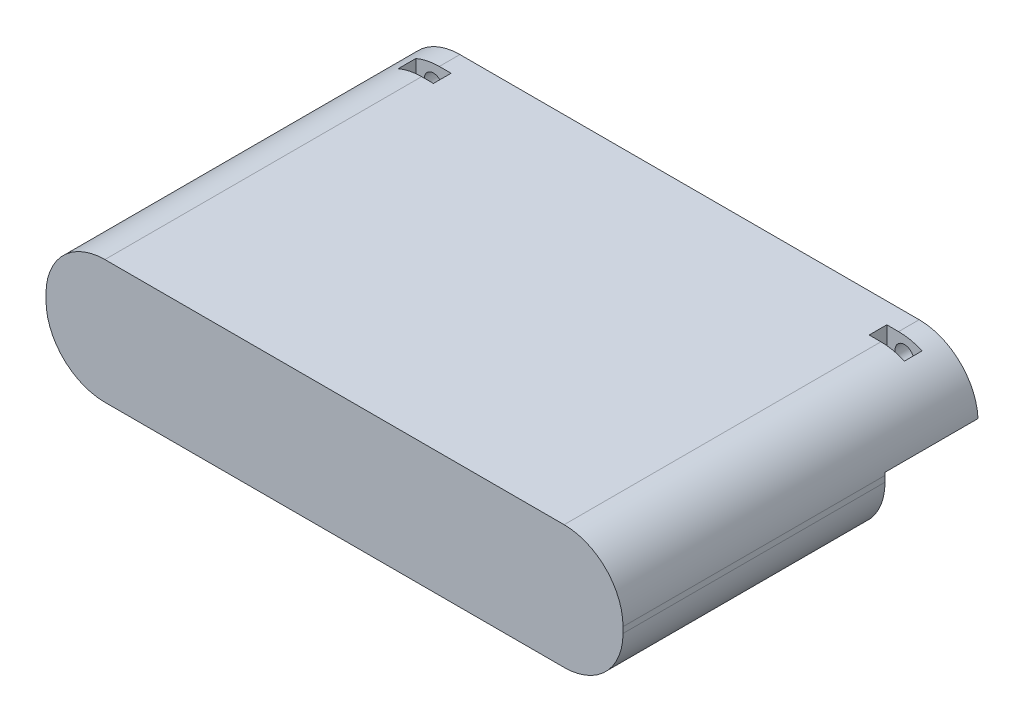
from build123d import *

# Parameters (mm, degrees)
SKETCH_1_W          = 49
SKETCH_1_H          = 21
SKETCH_1_R          = 4.1
SKETCH_1_R_2        = 1.6
EXTRUDE_1_DEPTH     = 57.8
SKETCH_4_W          = 98
SKETCH_4_H          = 11.45
CUT_EXTRUDE_3_DEPTH = 15.8
SKETCH_5_R          = 4.1
CUT_EXTRUDE_4_DEPTH = 42
SKETCH_6_W          = 98
SKETCH_6_H          = 21
EXTRUDE_2_DEPTH     = 2.5
SKETCH_7_R          = 1.6
SKETCH_7_R_2        = 1.534199572
CUT_EXTRUDE_5_DEPTH = 10
SKETCH_8_W          = 6
SKETCH_8_H          = 3
CUT_EXTRUDE_6_DEPTH = 7
FILLET_1_R          = 10
FILLET_2_R          = 10
FILLET_3_R          = 10
FILLET_4_R          = 10


with BuildPart() as part:
    # 草图1 → 凸台-拉伸1 (new body)
    # profile 1 of 6: a face of its own
    with BuildSketch(Plane.XY):
        with Locations((-24.5, 0)):
            Rectangle(SKETCH_1_W, SKETCH_1_H)
        with Locations((-40, -4.5)):
            Circle(SKETCH_1_R, mode=Mode.SUBTRACT)
        with Locations((-40, 7.5)):
            Circle(SKETCH_1_R_2, mode=Mode.SUBTRACT)
    # profile 2 of 6: a face of its own
    with BuildSketch(Plane.XY):
        with Locations((-40, -4.5)):
            Circle(SKETCH_1_R)
    # profile 3 of 6: a face of its own
    with BuildSketch(Plane.XY):
        with Locations((-40, 7.5)):
            Circle(SKETCH_1_R_2)
    # profile 4 of 6: a face of its own
    with BuildSketch(Plane.XY):
        with Locations((24.5, 0)):
            Rectangle(SKETCH_1_W, SKETCH_1_H)
        with Locations((40, -4.5)):
            Circle(SKETCH_1_R, mode=Mode.SUBTRACT)
        with Locations((40, 7.5)):
            Circle(SKETCH_1_R_2, mode=Mode.SUBTRACT)
    # profile 5 of 6: a face of its own
    with BuildSketch(Plane.XY):
        with Locations((40, -4.5)):
            Circle(SKETCH_1_R)
    # profile 6 of 6: a face of its own
    with BuildSketch(Plane.XY):
        with Locations((40, 7.5)):
            Circle(SKETCH_1_R_2)
    extrude(amount=EXTRUDE_1_DEPTH)

    # 草图4 → 切除-拉伸3 (cut)
    with BuildSketch(Plane(origin=(0, 0, 0), x_dir=(-1, 0, 0), z_dir=(0, 0, -1))):
        with Locations((0, -4.775)):
            Rectangle(SKETCH_4_W, SKETCH_4_H)
    extrude(amount=-CUT_EXTRUDE_3_DEPTH, mode=Mode.SUBTRACT)

    # 草图5 → 切除-拉伸4 (cut)
    with BuildSketch(Plane(origin=(0, 0, 15.8), x_dir=(-1, 0, 0), z_dir=(0, 0, -1))):
        with Locations((-40, -4.5)):
            Circle(SKETCH_5_R)
        with Locations((40, -4.5)):
            Circle(SKETCH_5_R)
    extrude(amount=-CUT_EXTRUDE_4_DEPTH, mode=Mode.SUBTRACT)

    # 草图6 → 凸台-拉伸2 (add)
    with BuildSketch(Plane.XY.offset(57.8)):
        Rectangle(SKETCH_6_W, SKETCH_6_H)
    extrude(amount=EXTRUDE_2_DEPTH)

    # 草图7 → 切除-拉伸5 (cut)
    with BuildSketch(Plane(origin=(0, 0, 0), x_dir=(-1, 0, 0), z_dir=(0, 0, -1))):
        with Locations((-40, 7.5)):
            Circle(SKETCH_7_R)
        with Locations((40, 7.5)):
            Circle(SKETCH_7_R_2)
    extrude(amount=-CUT_EXTRUDE_5_DEPTH, mode=Mode.SUBTRACT)

    # 草图8 → 切除-拉伸6 (cut)
    with BuildSketch(Plane(origin=(0, 10.5, 0), x_dir=(1, 0, 0), z_dir=(0, 1, 0))):
        with Locations((-40, -5)):
            Rectangle(SKETCH_8_W, SKETCH_8_H)
        with Locations((40, -5)):
            Rectangle(SKETCH_8_W, SKETCH_8_H)
    extrude(amount=-CUT_EXTRUDE_6_DEPTH, mode=Mode.SUBTRACT)

    # 圆角1
    # the kernel refuses this fillet: 10 mm, written as the material it takes off along each edge
    with BuildSketch(Plane(origin=(49, 10.5, -25), x_dir=(0, -1, 0), z_dir=(0, 0, 1))) as fillet_1_piece_1:
        with BuildLine():
            CenterArc((FILLET_1_R, -FILLET_1_R), FILLET_1_R, 90, 90)
            Line((0, -FILLET_1_R), (0, 0))
            Line((0, 0), (FILLET_1_R, 0))
        make_face()
    extrude(amount=110.3, mode=Mode.SUBTRACT)

    # 圆角2
    # the kernel refuses this fillet: 10 mm, written as the material it takes off along each edge
    with BuildSketch(Plane(origin=(-49, 10.5, 85.3), x_dir=(0, -1, 0), z_dir=(0, 0, -1))) as fillet_2_piece_1:
        with BuildLine():
            CenterArc((FILLET_2_R, -FILLET_2_R), FILLET_2_R, 90, 90)
            Line((0, -FILLET_2_R), (0, 0))
            Line((0, 0), (FILLET_2_R, 0))
        make_face()
    extrude(amount=110.3, mode=Mode.SUBTRACT)

    # 圆角3
    fillet_3_edges = [part.edges().sort_by_distance(p)[0] for p in [
        (-49, -10.5, 38.05),
    ]]
    fillet(fillet_3_edges, radius=FILLET_3_R)

    # 圆角4
    fillet_4_edges = [part.edges().sort_by_distance(p)[0] for p in [
        (49, -10.5, 38.05),
    ]]
    fillet(fillet_4_edges, radius=FILLET_4_R)


solid = part.part
